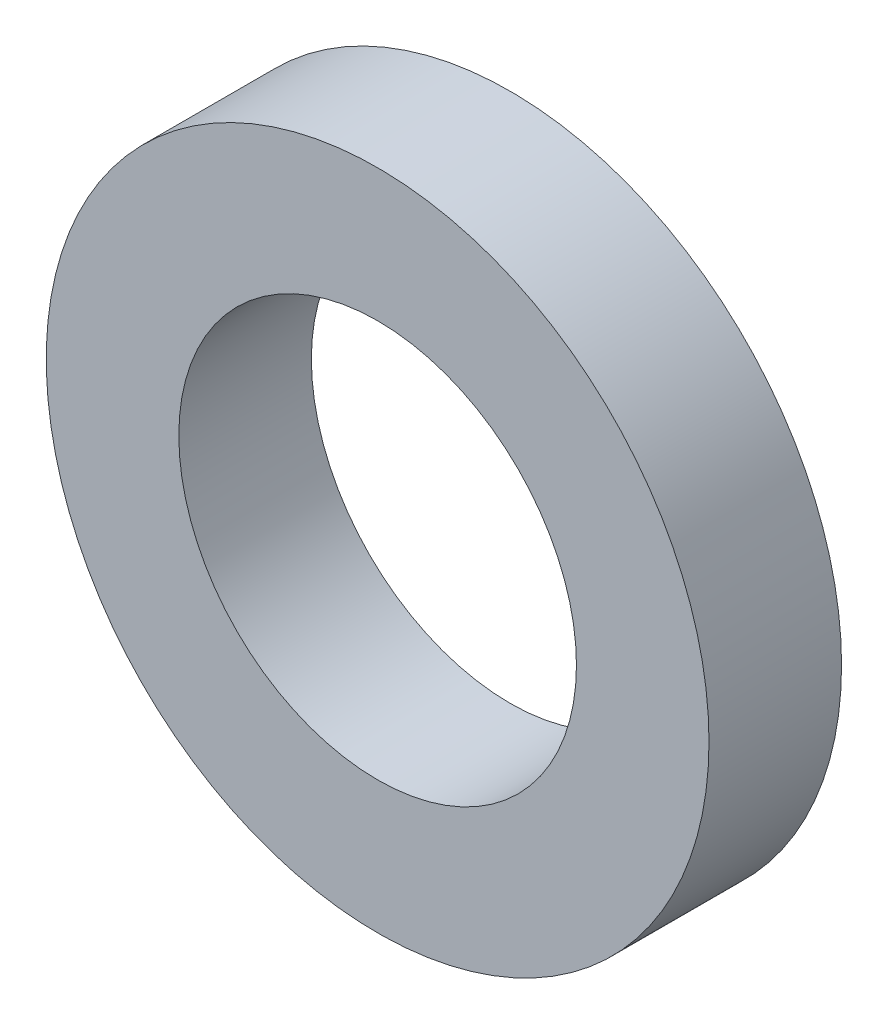
from build123d import *

# Parameters (mm, degrees)
SKETCH1_R           = 31.75
SKETCH1_R_2         = 19.05
BOSS_EXTRUDE1_DEPTH = 12.7


with BuildPart() as part:
    # Sketch1 → Boss-Extrude1 (new body)
    with BuildSketch(Plane.XY):
        Circle(SKETCH1_R)
        Circle(SKETCH1_R_2, mode=Mode.SUBTRACT)
    extrude(amount=BOSS_EXTRUDE1_DEPTH)


solid = part.part
